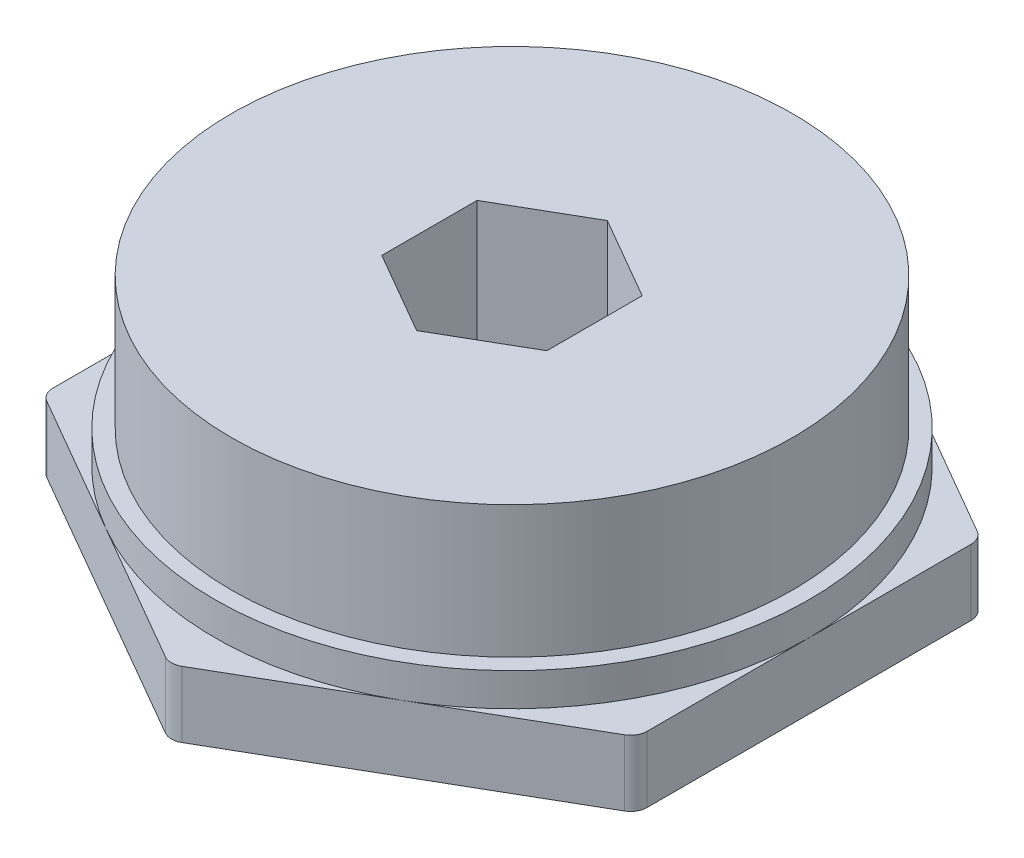
from build123d import *

# Parameters (mm, degrees)
BOSS_EXTRUDE1_DEPTH = 2
FILLET1_R           = 0.5
SKETCH2_R           = 9
BOSS_EXTRUDE2_DEPTH = 1
SKETCH3_R           = 8.5
BOSS_EXTRUDE3_DEPTH = 4
CUT_EXTRUDE1_DEPTH  = 16.375249198


with BuildPart() as part:
    # Sketch1 → Boss-Extrude1 (new body)
    with BuildSketch(Plane(origin=(0, 31, 0), x_dir=(1, 0, 0), z_dir=(0, 1, 0))):
        Polygon((0, 10.392304845), (-9, 5.196152423), (-9, -5.196152423), (0, -10.392304845), (9, -5.196152423), (9, 5.196152423), align=None)
    extrude(amount=BOSS_EXTRUDE1_DEPTH)

    # Fillet1
    fillet1_edges = [part.edges().sort_by_distance(p)[0] for p in [
        (0, 32, -10.392304845),
        (-9, 32, -5.196152423),
        (-9, 32, 5.196152423),
        (0, 32, 10.392304845),
        (9, 32, 5.196152423),
        (9, 32, -5.196152423),
    ]]
    fillet(fillet1_edges, radius=FILLET1_R)

    # Sketch2 → Boss-Extrude2 (add)
    with BuildSketch(Plane(origin=(0, 33, 0), x_dir=(1, 0, 0), z_dir=(0, 1, 0))):
        Circle(SKETCH2_R)
    extrude(amount=BOSS_EXTRUDE2_DEPTH)

    # Sketch3 → Boss-Extrude3 (add)
    with BuildSketch(Plane(origin=(0, 34, 0), x_dir=(1, 0, 0), z_dir=(0, 1, 0))):
        Circle(SKETCH3_R)
    extrude(amount=BOSS_EXTRUDE3_DEPTH)

    # Sketch4 → Cut-Extrude1 (cut, through all)
    with BuildSketch(Plane(origin=(0, 38, 0), x_dir=(1, 0, 0), z_dir=(0, 1, 0))):
        Polygon((0, 2.886751346), (-2.5, 1.443375673), (-2.5, -1.443375673), (0, -2.886751346), (2.5, -1.443375673), (2.5, 1.443375673), align=None)
    extrude(amount=-CUT_EXTRUDE1_DEPTH, mode=Mode.SUBTRACT)


solid = part.part
